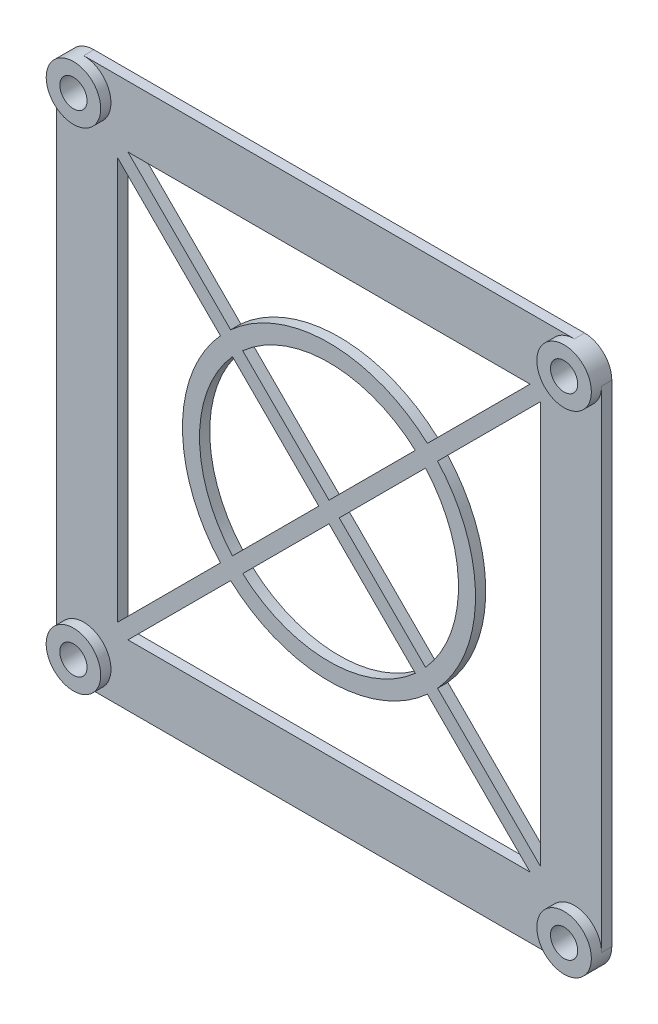
from build123d import *
from build123d.topology import SkipClean

# Parameters (mm, degrees)
SKETCH1_W             = 80
SKETCH1_H             = 80
BOSS_EXTRUDE1_DEPTH   = 1.5
FILLET1_R             = 4
BOSS_EXTRUDE2_START   = 1.5
SKETCH2_R             = 4
BOSS_EXTRUDE2_DEPTH   = 1.5
F_4_0MM_DOWEL_HOLE1_D = 4
CUT_EXTRUDE1_DEPTH    = 1.5


with BuildPart() as part:
    # Sketch1 → Boss-Extrude1 (new body)
    with BuildSketch(Plane.XY):
        with Locations((40, 40)):
            Rectangle(SKETCH1_W, SKETCH1_H)
    extrude(amount=BOSS_EXTRUDE1_DEPTH)

    # Fillet1
    fillet1_edges = [part.edges().sort_by_distance(p)[0] for p in [
        (0, 0, 0.75),
        (80, 0, 0.75),
        (80, 80, 0.75),
        (0, 80, 0.75),
    ]]
    fillet(fillet1_edges, radius=FILLET1_R)

    # Sketch2 → Boss-Extrude2 (add)
    with SkipClean():  # the faces are left unmerged after this step: merging them gives an invalid solid
        with BuildSketch(Plane.XY.offset(1.5).offset(BOSS_EXTRUDE2_START)):
            with Locations((4, 76)):
                Circle(SKETCH2_R)
            with Locations((76, 76)):
                Circle(SKETCH2_R)
            with Locations((4, 4)):
                Circle(SKETCH2_R)
            with Locations((76, 4)):
                Circle(SKETCH2_R)
        extrude(amount=-BOSS_EXTRUDE2_DEPTH)

    # Ø4.0mm Dowel Hole1 (through all)
    with Locations(Plane(origin=(0, 0, 0), x_dir=(-1, 0, 0), z_dir=(0, 0, -1))):
        with Locations((-4, 4), (-76, 4), (-76, 76), (-4, 76)):
            Hole(F_4_0MM_DOWEL_HOLE1_D / 2)

    # Sketch5 → Cut-Extrude1 (cut)
    with SkipClean():  # the faces are left unmerged after this step: merging them gives an invalid solid
        with BuildSketch(Plane(origin=(0, 0, 0), x_dir=(-1, 0, 0), z_dir=(0, 0, -1))):
            with BuildLine():
                Line((-10.5, 71), (-69.5, 71))
                Line((-69.5, 71), (-54.434284639, 55.934284639))
                ThreePointArc((-54.434284639, 55.934284639), (-40, 61.5), (-25.565715361, 55.934284639))
                Line((-25.565715361, 55.934284639), (-10.5, 71))
            make_face()
            with BuildLine():
                Line((-55.934284639, 54.434284639), (-71, 69.5))
                Line((-71, 69.5), (-71, 10.5))
                Line((-71, 10.5), (-55.934284639, 25.565715361))
                ThreePointArc((-55.934284639, 25.565715361), (-61.5, 40), (-55.934284639, 54.434284639))
            make_face()
            with BuildLine():
                Line((-9, 10.5), (-9, 69.5))
                Line((-9, 69.5), (-24.065715361, 54.434284639))
                ThreePointArc((-24.065715361, 54.434284639), (-18.5, 40), (-24.065715361, 25.565715361))
                Line((-24.065715361, 25.565715361), (-9, 10.5))
            make_face()
            with BuildLine():
                Line((-54.434284639, 24.065715361), (-69.5, 9))
                Line((-69.5, 9), (-10.5, 9))
                Line((-10.5, 9), (-25.565715361, 24.065715361))
                ThreePointArc((-25.565715361, 24.065715361), (-40, 18.5), (-54.434284639, 24.065715361))
            make_face()
            with BuildLine():
                Line((-54.164078425, 27.335921575), (-41.5, 40))
                Line((-41.5, 40), (-54.164078425, 52.664078425))
                ThreePointArc((-54.164078425, 52.664078425), (-59, 40), (-54.164078425, 27.335921575))
            make_face()
            with BuildLine():
                Line((-52.664078425, 54.164078425), (-40, 41.5))
                Line((-40, 41.5), (-27.335921575, 54.164078425))
                ThreePointArc((-27.335921575, 54.164078425), (-40, 59), (-52.664078425, 54.164078425))
            make_face()
            with BuildLine():
                Line((-25.835921575, 52.664078425), (-38.5, 40))
                Line((-38.5, 40), (-25.835921575, 27.335921575))
                ThreePointArc((-25.835921575, 27.335921575), (-21, 40), (-25.835921575, 52.664078425))
            make_face()
            with BuildLine():
                Line((-40, 38.5), (-52.664078425, 25.835921575))
                ThreePointArc((-52.664078425, 25.835921575), (-40, 21), (-27.335921575, 25.835921575))
                Line((-27.335921575, 25.835921575), (-40, 38.5))
            make_face()
        extrude(amount=-CUT_EXTRUDE1_DEPTH, mode=Mode.SUBTRACT)
    add(part.part.scale(1), mode=Mode.REPLACE)  # the faces are merged on a copy


solid = part.part
